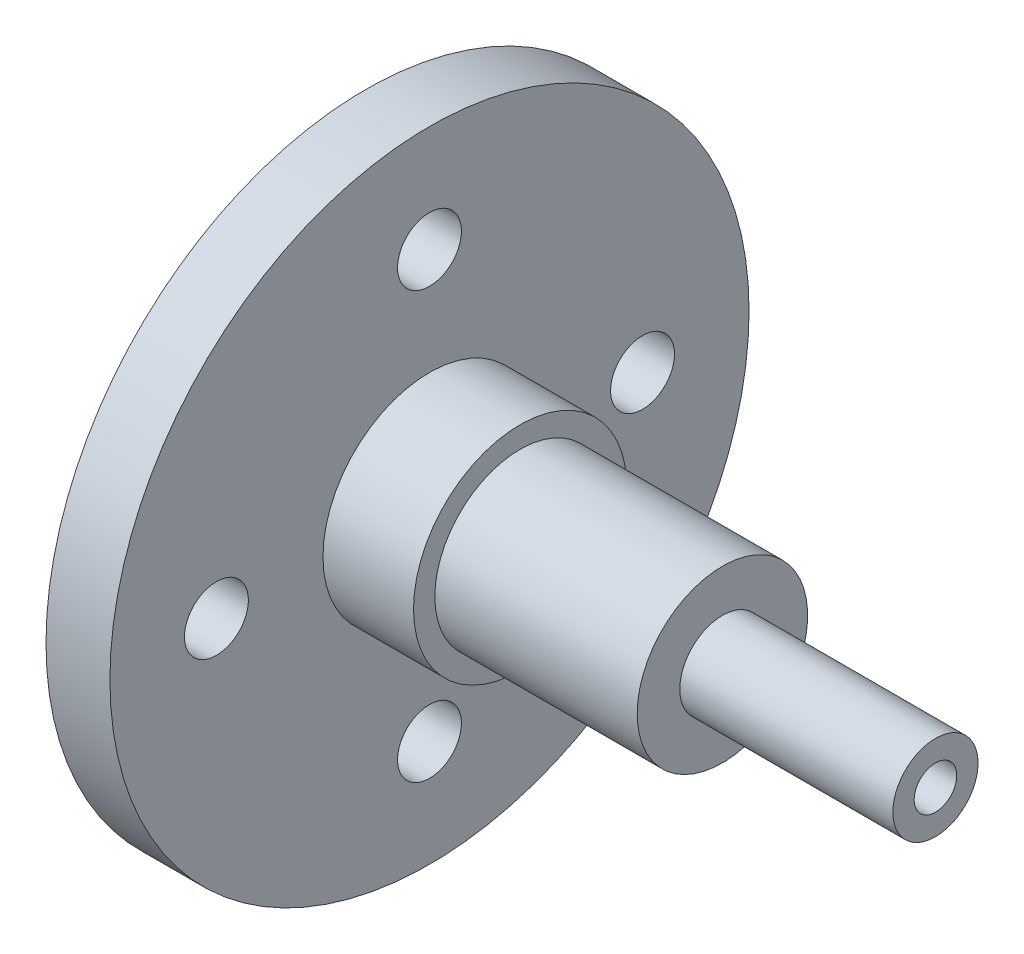
from build123d import *

# Parameters (mm, degrees)
SKETCH2_R          = 1.5
CUT_EXTRUDE1_DEPTH = 32.844348007


with BuildPart() as part:
    # Sketch1 → Revolve1 (revolve)
    with BuildSketch(Plane.XY):
        Polygon((-13.375, 1), (-13.375, 15), (-10.375, 15), (-10.375, 5), (-6.125, 5), (-6.125, 4), (3.375, 4), (3.375, 2), (13.375, 2), (13.375, 1), align=None)
    revolve(axis=Axis((-13.375, 0, 0), (1, 0, 0)))

    # Sketch2 → Cut-Extrude1 (cut, through all)
    with BuildSketch(Plane(origin=(-10.375, 0, 0), x_dir=(0, 0, -1), z_dir=(1, 0, 0))):
        with Locations((0, 10)):
            Circle(SKETCH2_R)
        with Locations((10, 0)):
            Circle(SKETCH2_R)
        with Locations((0, -10)):
            Circle(SKETCH2_R)
        with Locations((-10, 0)):
            Circle(SKETCH2_R)
    extrude(amount=-CUT_EXTRUDE1_DEPTH, mode=Mode.SUBTRACT)


solid = part.part
